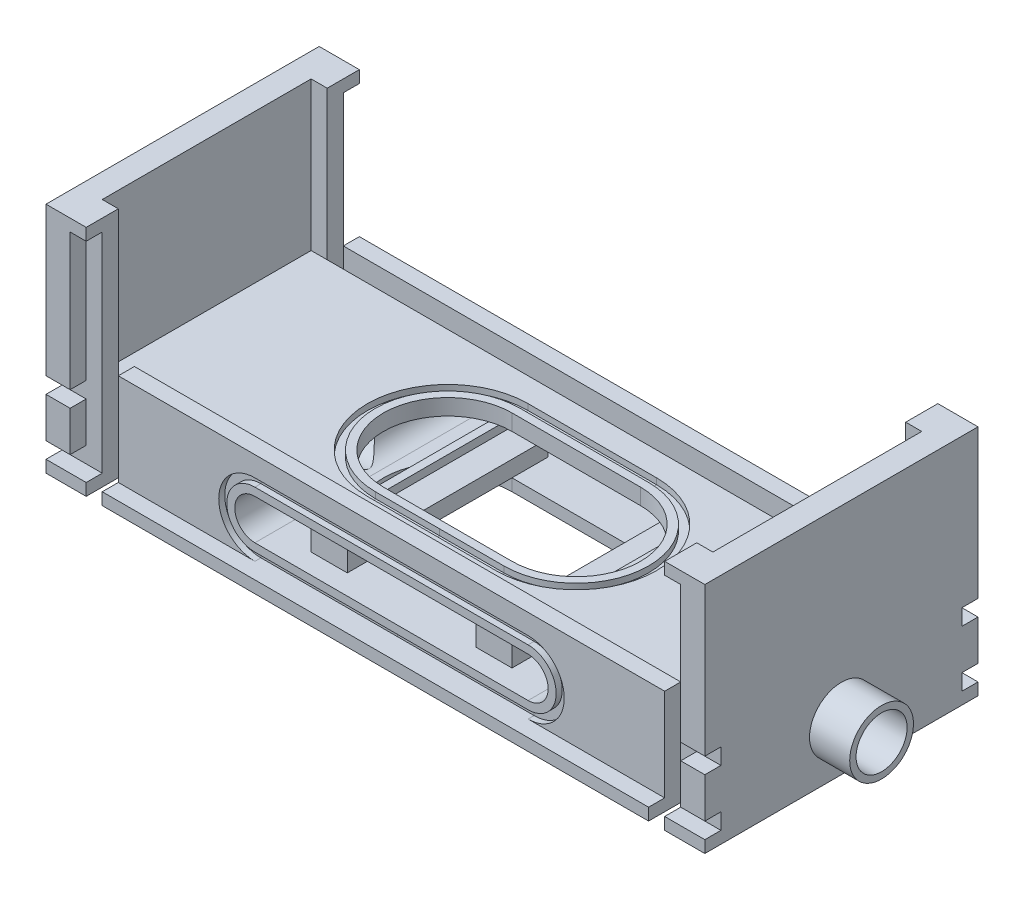
from build123d import *

# Parameters (mm, degrees)
SKETCH1_W                = 82
SKETCH1_H                = 34
BOSS_EXTRUDE2_DEPTH      = 14.5
CUT_EXTRUDE1_START       = 14.5
SKETCH1_4_W              = 76
SKETCH1_4_H              = 26
CUT_EXTRUDE1_DEPTH       = 18.5
CUT_SWEEP4_START         = -4.75
CUT_SWEEP4_DEPTH         = 0.75
SKETCH8_W                = 16
SKETCH8_H                = 16
CUT_EXTRUDE2_DEPTH       = 49.085860708
CUT_EXTRUDE7_START       = -14.5
SKETCH1_11_W             = 76
SKETCH1_11_H             = 26
CUT_EXTRUDE7_DEPTH       = 2
SKETCH35_W               = 76
SKETCH35_H               = 26
CUT_EXTRUDE11_DEPTH      = 2
SKETCH9_R                = 3.96875
BOSS_EXTRUDE3_DEPTH      = 5
SKETCH9_4_R              = 2.38125
CUT_EXTRUDE3_DEPTH       = 85.989705259
CUT_EXTRUDE13_START      = -20
SKETCH9_6_R              = 3.175
CUT_EXTRUDE13_DEPTH      = 105.989705355
CUT_SWEEP5_START         = -12.5
CUT_SWEEP5_DEPTH         = 0.75
CUT_SWEEP6_START         = -15
CUT_SWEEP6_DEPTH         = 0.75
SKETCH27_W               = 34
SKETCH27_H               = 5
CUT_EXTRUDE8_DEPTH       = 58.881344145
SKETCH28_W               = 3.5
SKETCH28_H               = 25
BOSS_EXTRUDE6_DEPTH      = 2
BOSS_EXTRUDE11_DEPTH     = 3
CUT_EXTRUDE9_DEPTH       = 57.800088028
SKETCH33_W               = 3
SKETCH33_H               = 2
CUT_EXTRUDE10_DEPTH      = 58.881344145
MIRROR11_COPY_1_DEPTH    = 57.800088028
MIRROR11_COPY_2_SKETCH_W = 3
MIRROR11_COPY_2_SKETCH_H = 2
MIRROR11_COPY_2_DEPTH    = 58.881344145


# Read off the part's stored shape, not the designer's step: Cut-Sweep4, Cut-Sweep5, Cut-Sweep6, Boss-Extrude11
with BuildPart() as part:
    # Sketch1 → Boss-Extrude2 (new, symmetric)
    with BuildSketch(Plane(origin=(0, 0, 0), x_dir=(1, 0, 0), z_dir=(0, 1, 0))):
        Rectangle(SKETCH1_W, SKETCH1_H)
    extrude(amount=BOSS_EXTRUDE2_DEPTH, both=True)

    # Sketch1<4> → Cut-Extrude1 (cut)
    with BuildSketch(Plane(origin=(0, 0, 0), x_dir=(1, 0, 0), z_dir=(0, 1, 0)).offset(CUT_EXTRUDE1_START)):
        Rectangle(SKETCH1_4_W, SKETCH1_4_H)
    extrude(amount=-CUT_EXTRUDE1_DEPTH, mode=Mode.SUBTRACT)

    # Cut-Sweep4 outline → Cut-Sweep4 (cut)
    with BuildSketch(Plane(origin=(0, 0, 0), x_dir=(1, 0, 0), z_dir=(0, 1, 0)).offset(CUT_SWEEP4_START)):
        with BuildLine():
            Line((-8, -10), (8, -10))
            ThreePointArc((8, -10), (18, 0), (8, 10))
            Line((8, 10), (-8, 10))
            ThreePointArc((-8, 10), (-18, 0), (-8, -10))
        make_face()
        with BuildLine():
            Line((8, -9), (-8, -9))
            ThreePointArc((-8, -9), (-17, 0), (-8, 9))
            Line((-8, 9), (8, 9))
            ThreePointArc((8, 9), (17, 0), (8, -9))
        make_face(mode=Mode.SUBTRACT)
    extrude(amount=CUT_SWEEP4_DEPTH, mode=Mode.SUBTRACT)

    # Sketch8 → Cut-Extrude2 (cut, through all)
    with BuildSketch(Plane(origin=(0, -4, 0), x_dir=(1, 0, 0), z_dir=(0, 1, 0))):
        with BuildLine():
            Line((-8, 8), (-8, -8))
            ThreePointArc((-8, -8), (-16, 0), (-8, 8))
        make_face()
        Rectangle(SKETCH8_W, SKETCH8_H)
        with BuildLine():
            Line((8, 8), (8, -8))
            ThreePointArc((8, -8), (16, 0), (8, 8))
        make_face()
    extrude(amount=-CUT_EXTRUDE2_DEPTH, mode=Mode.SUBTRACT)

    # Sketch1<11> → Cut-Extrude7 (cut)
    with BuildSketch(Plane(origin=(0, 0, 0), x_dir=(1, 0, 0), z_dir=(0, 1, 0)).offset(CUT_EXTRUDE7_START)):
        Rectangle(SKETCH1_11_W, SKETCH1_11_H)
    extrude(amount=CUT_EXTRUDE7_DEPTH, mode=Mode.SUBTRACT)

    # Sketch35 → Cut-Extrude11 (cut)
    with BuildSketch(Plane(origin=(0, 0, -17), x_dir=(-1, 0, 0), z_dir=(0, 0, -1))):
        Rectangle(SKETCH35_W, SKETCH35_H)
    cut_extrude11 = extrude(amount=-CUT_EXTRUDE11_DEPTH, mode=Mode.SUBTRACT)

    # Mirror12: Cut-Extrude11 across plane
    add(cut_extrude11.mirror(Plane.XY), mode=Mode.SUBTRACT)

    # Sketch9 → Boss-Extrude3 (add)
    with BuildSketch(Plane.ZY.offset(41)):
        with Locations(Location((0, -8.5, 0), (0, 0, 180))):
            Circle(SKETCH9_R)
    boss_extrude3 = extrude(amount=BOSS_EXTRUDE3_DEPTH)

    # Sketch9<4> → Cut-Extrude3 (cut, symmetric)
    with BuildSketch(Plane.ZY.offset(41)):
        with Locations((0, -8.5)):
            Circle(SKETCH9_4_R)
    cut_extrude3 = extrude(amount=CUT_EXTRUDE3_DEPTH, both=True, mode=Mode.SUBTRACT)

    # Sketch9<6> → Cut-Extrude13 (cut)
    with BuildSketch(Plane.ZY.offset(41).offset(CUT_EXTRUDE13_START)):
        with Locations((0, -8.5)):
            Circle(SKETCH9_6_R)
    cut_extrude13 = extrude(amount=CUT_EXTRUDE13_DEPTH, mode=Mode.SUBTRACT)

    # Mirror13: Boss-Extrude3, Cut-Extrude3, Cut-Extrude13 across plane
    add(boss_extrude3.mirror(Plane(origin=(0, 0, 0), x_dir=(0, 0, 1), z_dir=(1, 0, 0))))
    add(cut_extrude3.mirror(Plane(origin=(0, 0, 0), x_dir=(0, 0, 1), z_dir=(1, 0, 0))), mode=Mode.SUBTRACT)
    add(cut_extrude13.mirror(Plane(origin=(0, 0, 0), x_dir=(0, 0, 1), z_dir=(1, 0, 0))), mode=Mode.SUBTRACT)

    # Cut-Sweep5 outline → Cut-Sweep5 (cut)
    with BuildSketch(Plane(origin=(0, 0, 0), x_dir=(1, 0, 0), z_dir=(0, 1, 0)).offset(CUT_SWEEP5_START)):
        with BuildLine():
            Line((-8, -10), (8, -10))
            ThreePointArc((8, -10), (18, 0), (8, 10))
            Line((8, 10), (-8, 10))
            ThreePointArc((-8, 10), (-18, 0), (-8, -10))
        make_face()
        with BuildLine():
            Line((8, -9), (-8, -9))
            ThreePointArc((-8, -9), (-17, 0), (-8, 9))
            Line((-8, 9), (8, 9))
            ThreePointArc((8, 9), (17, 0), (8, -9))
        make_face(mode=Mode.SUBTRACT)
    extrude(amount=CUT_SWEEP5_DEPTH, mode=Mode.SUBTRACT)

    # Cut-Sweep6 outline → Cut-Sweep6 (cut)
    with BuildSketch(Plane.XY.offset(CUT_SWEEP6_START)):
        with BuildLine():
            ThreePointArc((-17, -4), (-21.5, -8.5), (-17, -13))
            Line((-17, -13), (17, -13))
            ThreePointArc((17, -13), (21.5, -8.5), (17, -4))
            Line((17, -4), (-17, -4))
        make_face()
        with BuildLine():
            Line((-17, -5), (17, -5))
            ThreePointArc((17, -5), (20.5, -8.5), (17, -12))
            Line((17, -12), (-17, -12))
            ThreePointArc((-17, -12), (-20.5, -8.5), (-17, -5))
        make_face(mode=Mode.SUBTRACT)
    cut_sweep6 = extrude(amount=CUT_SWEEP6_DEPTH, mode=Mode.SUBTRACT)

    # Sketch27 → Cut-Extrude8 (cut, through all)
    with BuildSketch(Plane(origin=(0, 0, -15), x_dir=(-1, 0, 0), z_dir=(0, 0, -1))):
        with Locations((0, -8.5)):
            Rectangle(SKETCH27_W, SKETCH27_H)
        with BuildLine():
            Line((-17, -11), (-17, -6))
            ThreePointArc((-17, -6), (-19.5, -8.5), (-17, -11))
        make_face()
        with BuildLine():
            Line((17, -11), (17, -6))
            ThreePointArc((17, -6), (19.5, -8.5), (17, -11))
        make_face()
    extrude(amount=-CUT_EXTRUDE8_DEPTH, mode=Mode.SUBTRACT)

    # Mirror8: Cut-Sweep6 across plane
    add(cut_sweep6.mirror(Plane.XY), mode=Mode.SUBTRACT)

    # Sketch28 → Boss-Extrude6 (add)
    with BuildSketch(Plane(origin=(0, -11, 0), x_dir=(1, 0, 0), z_dir=(0, 1, 0))):
        with Locations((9.75, 0)):
            Rectangle(SKETCH28_W, SKETCH28_H)
    boss_extrude6 = extrude(amount=BOSS_EXTRUDE6_DEPTH)

    # Boss-Extrude11 outline → Boss-Extrude11 (add)
    with BuildSketch(Plane(origin=(0, -11, 0), x_dir=(1, 0, 0), z_dir=(0, 1, 0))):
        Polygon((12.5, -12.5), (12.5, 12.5), (8, 12.5), (8, 11.5), (11.5, 11.5), (11.5, -11.5), (8, -11.5), (8, -12.5), align=None)
    boss_extrude11 = extrude(amount=BOSS_EXTRUDE11_DEPTH)

    # Sketch32 → Cut-Extrude9 (cut, through all)
    with BuildSketch(Plane(origin=(0, 0, 13), x_dir=(-1, 0, 0), z_dir=(0, 0, -1))):
        Polygon((-34, 3.5), (-34, 14.5), (-36, 14.5), (-36, -15.5), (-34, -15.5), (-34, -1.5), (-34, 0), align=None)
        Polygon((0, 14.5), (-34, 14.5), (-34, 3.5), (-34, 0), (-34, -1.5), (0, -1.5), align=None)
    cut_extrude9 = extrude(amount=-CUT_EXTRUDE9_DEPTH, mode=Mode.SUBTRACT)

    # Sketch33 → Cut-Extrude10 (cut, through all)
    with BuildSketch(Plane.XY.offset(15)):
        with Locations((39.5, -12)):
            Rectangle(SKETCH33_W, SKETCH33_H)
        with Locations((39.5, -5)):
            Rectangle(SKETCH33_W, SKETCH33_H)
    cut_extrude10 = extrude(amount=CUT_EXTRUDE10_DEPTH, mode=Mode.SUBTRACT)

    # Mirror10: Cut-Extrude9, Cut-Extrude10 across plane
    add(cut_extrude9.mirror(Plane.XY), mode=Mode.SUBTRACT)
    add(cut_extrude10.mirror(Plane.XY), mode=Mode.SUBTRACT)

    # Mirror11: Boss-Extrude6, Boss-Extrude11, Cut-Extrude9, Cut-Extrude10 across plane
    add(boss_extrude6.mirror(Plane(origin=(0, 0, 0), x_dir=(0, 0, 1), z_dir=(1, 0, 0))))
    add(boss_extrude11.mirror(Plane(origin=(0, 0, 0), x_dir=(0, 0, 1), z_dir=(1, 0, 0))))
    add(cut_extrude9.mirror(Plane(origin=(0, 0, 0), x_dir=(0, 0, 1), z_dir=(1, 0, 0))), mode=Mode.SUBTRACT)
    add(cut_extrude10.mirror(Plane(origin=(0, 0, 0), x_dir=(0, 0, 1), z_dir=(1, 0, 0))), mode=Mode.SUBTRACT)

    # Mirror11 copy 1 sketch → Mirror11 copy 1 (cut, through all)
    with BuildSketch(Plane.XY.offset(-13)):
        Polygon((-34, 3.5), (-34, 14.5), (-36, 14.5), (-36, -15.5), (-34, -15.5), (-34, -1.5), (-34, 0), align=None)
        Polygon((0, 14.5), (-34, 14.5), (-34, 3.5), (-34, 0), (-34, -1.5), (0, -1.5), align=None)
    extrude(amount=-MIRROR11_COPY_1_DEPTH, mode=Mode.SUBTRACT)

    # Mirror11 copy 2 sketch → Mirror11 copy 2 (cut, through all)
    with BuildSketch(Plane(origin=(0, 0, -15), x_dir=(-1, 0, 0), z_dir=(0, 0, -1))):
        with Locations((39.5, -12)):
            Rectangle(MIRROR11_COPY_2_SKETCH_W, MIRROR11_COPY_2_SKETCH_H)
        with Locations((39.5, -5)):
            Rectangle(MIRROR11_COPY_2_SKETCH_W, MIRROR11_COPY_2_SKETCH_H)
    extrude(amount=MIRROR11_COPY_2_DEPTH, mode=Mode.SUBTRACT)


solid = part.part
